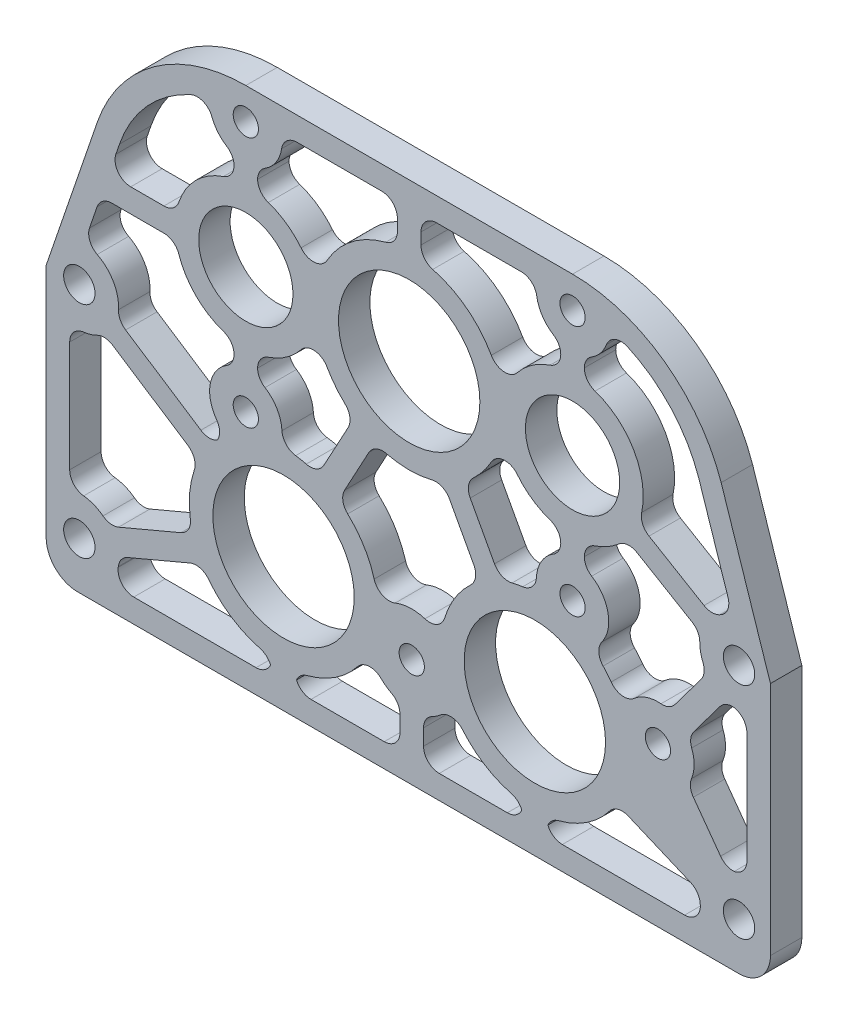
from build123d import *

# Parameters (mm, degrees)
SKETCH1_R           = 14.2875
SKETCH1_R_2         = 14.287500000000035
SKETCH1_R_3         = 14.287500000000005
SKETCH1_R_4         = 2.552699999999997
SKETCH1_R_5         = 2.5527000000000015
SKETCH1_R_6         = 2.5526999999999953
SKETCH1_R_7         = 2.5526999999999966
SKETCH1_R_8         = 9.525
SKETCH1_R_9         = 9.524999999999999
SKETCH1_R_10        = 2.5527000000000104
SKETCH1_R_11        = 2.5527000000000006
SKETCH1_R_12        = 3.175000000000977
SKETCH1_R_13        = 3.175000000000985
BOSS_EXTRUDE2_DEPTH = 6.35
FILLET1_R           = 6.35
CUT_EXTRUDE3_DEPTH  = 10.795
FILLET3_R           = 3.175
BOSS_EXTRUDE3_DEPTH = 6.35
FILLET4_R           = 3.175


with BuildPart() as part:
    # Sketch1 → Boss-Extrude2 (new body)
    with BuildSketch(Plane.XY):
        with BuildLine():
            Line((-47.98603132887341, -26.98750000000001), (98.42499999999998, -26.98750000000001))
            Line((98.42499999999998, -26.98750000000001), (98.42500000000001, 26.98749999999999))
            Line((98.42500000000001, 26.98749999999999), (88.46195482333482, 57.1775449004279))
            ThreePointArc((88.46195482333482, 57.1775449004279), (76.88457370138293, 72.73281600473805), (58.419999999999995, 78.65411069405324))
            Line((58.419999999999995, 78.65411069405324), (-7.620000000000009, 78.65411069405323))
            ThreePointArc((-7.620000000000009, 78.65411069405323), (-26.084573701382947, 72.73281600473804), (-37.661954823334845, 57.17754490042788))
            Line((-37.661954823334845, 57.17754490042788), (-47.98603132887343, 26.98749999999999))
            Line((-47.98603132887343, 26.98749999999999), (-47.98603132887341, -26.98750000000001))
        make_face()
        Circle(SKETCH1_R, mode=Mode.SUBTRACT)
        with Locations((50.80000000000001, 0)):
            Circle(SKETCH1_R_2, mode=Mode.SUBTRACT)
        with Locations((25.39999999999999, 46.90411069405324)):
            Circle(SKETCH1_R_3, mode=Mode.SUBTRACT)
        with Locations((-7.6200000000000125, 72.30411069405324)):
            Circle(SKETCH1_R_4, mode=Mode.SUBTRACT)
        with Locations((-7.620000000000007, 21.50411069405324)):
            Circle(SKETCH1_R_5, mode=Mode.SUBTRACT)
        with Locations((58.42, 72.30411069405325)):
            Circle(SKETCH1_R_6, mode=Mode.SUBTRACT)
        with Locations((58.42000000000001, 21.504110694053246)):
            Circle(SKETCH1_R_7, mode=Mode.SUBTRACT)
        with Locations((58.419999999999995, 46.90411069405324)):
            Circle(SKETCH1_R_8, mode=Mode.SUBTRACT)
        with Locations((-7.620000000000009, 46.90411069405323)):
            Circle(SKETCH1_R_9, mode=Mode.SUBTRACT)
        with Locations((75.68317984244781, 5.097779999999989)):
            Circle(SKETCH1_R_10, mode=Mode.SUBTRACT)
        with Locations((25.916820157552216, -5.097779999999997)):
            Circle(SKETCH1_R_11, mode=Mode.SUBTRACT)
        with Locations((-41.275, 26.98749999999999)):
            Circle(SKETCH1_R_12, mode=Mode.SUBTRACT)
        with Locations((92.07499999999999, 26.98749999999999)):
            Circle(SKETCH1_R_13, mode=Mode.SUBTRACT)
        with Locations((-41.275, -17.462500000000013)):
            Circle(SKETCH1_R_12, mode=Mode.SUBTRACT)
        with Locations((92.07499999999999, -17.462500000000013)):
            Circle(SKETCH1_R_13, mode=Mode.SUBTRACT)
    extrude(amount=BOSS_EXTRUDE2_DEPTH)

    # Fillet1
    fillet1_edges = [part.edges().sort_by_distance(p)[0] for p in [
        (98.42499999999998, -26.98750000000001, 3.175),
        (-47.98603132887341, -26.98750000000001, 3.175),
    ]]
    fillet(fillet1_edges, radius=FILLET1_R)

    # Sketch3 → Cut-Extrude3 (cut)
    with BuildSketch(Plane.XY.offset(6.35)):
        with BuildLine():
            Line((-36.956198173075435, 44.52286069405322), (-40.26063056999918, 34.85991772961107))
            ThreePointArc((-40.260630569999265, 34.85991772961111), (-35.31448560941896, 32.22927207151282), (-33.33749999999902, 26.98749999999999))
            ThreePointArc((-33.33749999999902, 26.987499999999986), (-33.41208001998004, 25.90196066961234), (-33.634418585906, 24.836820594645292))
            Line((-33.63441858590588, 24.8368205946454), (-14.516078562779157, 12.336367502601007))
            ThreePointArc((-14.516078562779489, 12.336367502600337), (-13.047510630612942, 13.880380626771089), (-11.41569108705963, 15.250721196219777))
            ThreePointArc((-11.415691087059542, 15.250721196219537), (-14.893374011307559, 22.28525186672046), (-10.001250000000171, 28.420887362234687))
            Line((-10.00125000000001, 28.42088736223464), (-10.00125000000001, 32.81644571054716))
            ThreePointArc((-10.001249999999667, 32.816445710547214), (-17.722788136202837, 36.80132255785047), (-21.707664983506042, 44.52286069405366))
            Line((-21.70766498350611, 44.52286069405323), (-36.956198173075435, 44.52286069405322))
        make_face()
        with BuildLine():
            Line((-33.15566159983462, 55.636529769471686), (-35.32756812234866, 49.28536069405323))
            Line((-35.32756812234866, 49.28536069405323), (-21.70766498350611, 49.28536069405323))
            ThreePointArc((-21.707664983506042, 49.2853606940528), (-17.72278813620284, 57.00689883025599), (-10.001249999999668, 60.99177567755925))
            Line((-10.001250000000011, 60.9917756775593), (-10.001250000000011, 65.38733402587184))
            ThreePointArc((-10.001250000000171, 65.3873340258718), (-13.740187498084108, 68.29718468671356), (-14.911873650189097, 72.88783126905301))
            ThreePointArc((-14.91187365018921, 72.8878312690532), (-26.1622118018659, 66.51307644303513), (-33.15566159983462, 55.63652976947169))
        make_face()
        with BuildLine():
            Line((-43.22353132887343, 19.292882926329938), (-43.22353132887341, -9.767882926329964))
            ThreePointArc((-43.22353132887338, -9.767882926329973), (-38.86174796951349, -9.900746176490003), (-35.229365288806136, -12.319134643657591))
            Line((-35.22936528880609, -12.319134643657936), (-18.334650894259735, -5.171370861349857))
            ThreePointArc((-18.334650894259855, -5.1713708613496445), (-18.973894873865273, 1.701121193656982), (-17.122353653984312, 8.350299716051511))
            Line((-17.122353653984035, 8.35029971605184), (-36.240693677111, 20.85075280809639))
            ThreePointArc((-36.240693677110954, 20.850752808096534), (-39.54663618686575, 19.24045767537935), (-43.22353132887338, 19.292882926329952))
        make_face()
        with BuildLine():
            Line((23.53557015755222, -22.22500000000001), (23.53557015755222, -13.676108259486211))
            ThreePointArc((23.53557015755219, -13.676108259486215), (19.714337890332565, -11.484272074278785), (17.41175399161535, -7.7287335919578615))
            ThreePointArc((17.411753991615605, -7.728733591957864), (1.0264443168908546, -19.02232667326272), (-16.47899043790001, -9.5574773945639))
            Line((-16.47899043790001, -9.55747739456389), (-33.37370483244626, -16.705241176871922))
            ThreePointArc((-33.37370483244611, -16.70524117687212), (-33.34655637459399, -17.083438093744068), (-33.33749999999902, -17.462500000000013))
            ThreePointArc((-33.33749999999902, -17.462500000000016), (-33.74482632172297, -19.972557892758534), (-34.92499999999866, -22.224999999999863))
            Line((-34.924999999998604, -22.225000000000012), (23.535570157552222, -22.225000000000012))
        make_face()
        with BuildLine():
            ThreePointArc((33.96205809858209, -8.909894080430089), (31.64893251655826, -11.909604659643707), (28.298070157552345, -13.676108259486186))
            Line((28.29807015755222, -13.676108259486156), (28.29807015755222, -22.22500000000001))
            Line((28.298070157552225, -22.225000000000012), (85.72499999999897, -22.225000000000012))
            ThreePointArc((85.7249999999989, -22.2250000000002), (84.43354805324476, -19.610084316260135), (84.17370483244609, -16.705241176872093))
            Line((84.17370483244622, -16.705241176871912), (67.27899043790006, -9.557477394563913))
            ThreePointArc((67.27899043790005, -9.557477394563927), (50.42979387433956, -19.046402479852333), (33.96205809858229, -8.909894080430064))
        make_face()
        with BuildLine():
            ThreePointArc((11.094212526660076, 15.486153441487609), (16.815305248793134, 8.952542063007014), (19.041814265400653, 0.5583990347270906))
            ThreePointArc((19.041814265400927, 0.5583990347269845), (25.21333999610085, 3.7770824187896235), (31.81487826203277, 1.5708763778748782))
            ThreePointArc((31.814878262032774, 1.57087637787488), (34.22893119349048, 9.396923890823444), (39.7057874733399, 15.486153441487637))
            Line((39.70578747334045, 15.486153441487858), (32.306345500404845, 29.150100109708138))
            ThreePointArc((32.30634550040487, 29.15010010970815), (25.399999999999988, 27.854110694053233), (18.49365449959512, 29.150100109708145))
            Line((18.493654499595145, 29.150100109708134), (11.094212526659529, 15.486153441487827))
        make_face()
        with BuildLine():
            ThreePointArc((-0.733789074029272, 19.035862302371154), (3.1521261342067666, 18.787405377913434), (6.906345500404873, 17.75401058434508))
            Line((6.90634550040485, 17.754010584345107), (14.305787473340464, 31.41795725256541))
            ThreePointArc((14.305787473339901, 31.41795725256563), (9.005326897633584, 37.20270904962352), (6.485853365384578, 44.63308513623436))
            ThreePointArc((6.485853365384638, 44.63308513623435), (2.5222081508117062, 36.84089698889878), (-5.2387500000004685, 32.81644571054719))
            Line((-5.238750000000011, 32.81644571054712), (-5.23875000000001, 28.420887362234687))
            ThreePointArc((-5.238749999999918, 28.420887362234712), (-1.664688461549618, 25.752217980833986), (-0.3048000000000055, 21.50411069405324))
            ThreePointArc((-0.3048000000000055, 21.504110694053235), (-0.4128451797654238, 20.251485276312792), (-0.733789074029267, 19.035862302371147))
        make_face()
        with BuildLine():
            ThreePointArc((6.485853365384575, 49.1751362518721), (11.890409000038312, 60.33517360857175), (23.018749999999926, 65.8046966224709))
            Line((23.01874999999999, 65.8046966224709), (23.01874999999999, 73.89161069405323))
            Line((23.01874999999999, 73.89161069405323), (-0.4791320702592614, 73.89161069405323))
            ThreePointArc((-0.47913207025925786, 73.89161069405321), (-0.34851362788737994, 73.10263244089562), (-0.30480000000001706, 72.30411069405324))
            ThreePointArc((-0.30480000000001706, 72.30411069405324), (-1.6646884615496287, 68.0560034072725), (-5.238749999999925, 65.38733402587177))
            Line((-5.238750000000013, 65.3873340258718), (-5.238750000000013, 60.99177567755933))
            ThreePointArc((-5.238750000000456, 60.99177567755926), (2.5222081508117205, 56.96732439920767), (6.485853365384641, 49.1751362518721))
        make_face()
        with BuildLine():
            Line((27.781249999999993, 73.89161069405323), (27.781249999999993, 65.80469662247086))
            ThreePointArc((27.781250000000203, 65.80469662247089), (38.909590999961345, 60.33517360857208), (44.31414663461528, 49.17513625187318))
            ThreePointArc((44.31414663461551, 49.17513625187317), (48.27779184918861, 56.967324399208024), (56.03875000000034, 60.99177567755926))
            Line((56.03875, 60.99177567755932), (56.03875, 65.38733402587185))
            ThreePointArc((56.03874999999984, 65.38733402587181), (52.036555563082146, 68.73146627279014), (51.27913207025928, 73.89161069405337))
            Line((51.27913207025931, 73.89161069405323), (27.781249999999993, 73.89161069405323))
        make_face()
        with BuildLine():
            Line((36.49421252665954, 31.417957252565405), (43.893654499595144, 17.754010584345135))
            ThreePointArc((43.893654499595115, 17.75401058434512), (47.64787386579323, 18.787405377913473), (51.533789074029265, 19.035862302371196))
            ThreePointArc((51.53378907402926, 19.035862302371186), (51.82521934806276, 24.669710035857907), (56.03874999999985, 28.420887362234694))
            Line((56.03875000000001, 28.420887362234648), (56.03875000000001, 32.81644571054716))
            ThreePointArc((56.03875000000035, 32.816445710547214), (48.27779184918861, 36.84089698889845), (44.31414663461551, 44.63308513623329))
            ThreePointArc((44.31414663461528, 44.63308513623328), (41.79467310236612, 37.202709049623046), (36.49421252666008, 31.41795725256563))
        make_face()
        with BuildLine():
            ThreePointArc((86.77141129191, 32.893078131346314), (88.65782919870398, 34.15177595537648), (90.8231844590936, 34.82566713916977))
            Line((90.82318445909374, 34.825667139169845), (83.94770767447324, 55.65975442462171))
            ThreePointArc((83.94770767447324, 55.65975442462171), (76.95329132995386, 66.52150778768062), (65.7118736501892, 72.88783126905322))
            ThreePointArc((65.71187365018908, 72.88783126905304), (65.72936608625751, 72.59620392757364), (65.73519999999999, 72.30411069405325))
            ThreePointArc((65.73519999999999, 72.30411069405325), (64.37531153845039, 68.05600340727251), (60.80125000000009, 65.38733402587178))
            Line((60.80125, 65.38733402587181), (60.80125, 60.991775677559346))
            ThreePointArc((60.801249999999555, 60.991775677559275), (69.33225837361344, 56.12665228720982), (72.7075, 46.90411069405324))
            ThreePointArc((72.7075, 46.90411069405324), (72.46774410280621, 44.297668315623746), (71.75652301003349, 41.77870239296668))
            Line((71.75652301003355, 41.778702392966736), (86.77141129191, 32.8930781313463))
        make_face()
        with BuildLine():
            ThreePointArc((65.7352, 21.504110694053242), (64.79488786097679, 17.916220534088623), (62.21569108705957, 15.250721196219562))
            ThreePointArc((62.21569108705967, 15.25072119621981), (65.99074435348669, 11.495381071848566), (68.57894332826864, 6.841905738185394))
            ThreePointArc((68.57894332826845, 6.841905738185389), (72.11570790549615, 11.484116588300243), (77.92305777838881, 12.061622177425093))
            Line((77.9230577783889, 12.06162217742498), (85.63031518720337, 22.353932916885178))
            ThreePointArc((85.63031518720346, 22.353932916885146), (84.29077822768011, 25.435147704495904), (84.34591976745322, 28.794493361601123))
            Line((84.34591976745313, 28.794493361601035), (69.33103148557676, 37.680117623221406))
            ThreePointArc((69.3310314855768, 37.68011762322152), (65.4970765780429, 34.492517590888895), (60.80124999999956, 32.8164457105472))
            Line((60.80125000000001, 32.81644571054713), (60.80125000000001, 28.420887362234687))
            ThreePointArc((60.8012500000001, 28.420887362234716), (64.3753115384504, 25.75221798083399), (65.7352, 21.504110694053246))
        make_face()
        with BuildLine():
            Line((81.67533037001955, 0.9017958371459294), (89.55064659468412, -9.937106579381512))
            ThreePointArc((89.55064659468395, -9.93710657938173), (91.58995732793704, -9.539833791185352), (93.66250000000025, -9.685370066662468))
            Line((93.6625, -9.685370066662518), (93.66250000000001, 19.210370066662346))
            ThreePointArc((93.66249999999987, 19.210370066662367), (91.5328726433143, 19.068535157348606), (89.44244322329315, 19.49927250162425))
            Line((89.4424432232932, 19.499272501624198), (81.73518581447874, 9.20696176216401))
            ThreePointArc((81.73518581447883, 9.20696176216398), (82.67545361878842, 7.247258652301386), (82.99837984244782, 5.097779999999989))
            ThreePointArc((82.99837984244782, 5.097779999999987), (82.65978111309862, 2.897965064521601), (81.67533037001952, 0.9017958371459089))
        make_face()
    extrude(amount=-CUT_EXTRUDE3_DEPTH, mode=Mode.SUBTRACT)

    # Fillet3
    # the kernel refuses this fillet: 3.175 mm, written as the material it adds along each edge
    with BuildSketch(Plane(origin=(56.03874999999993, 28.420887362234673, 6.35), x_dir=(-0.9026615864451203, -0.4303510896423738, 0), z_dir=(0, 0, -1))) as fillet3_piece_1:
        with BuildLine():
            CenterArc((2.013377815079917, 3.1546363422735153), FILLET3_R, 205.48984323361395, 58.0174460297045)
            Line((-0.8525727218857884, 1.7882716326641204), (0, 0))
            ThreePointArc((0, 0), (0.827179473242506, 0.04691786740182201), (1.6543589464849966, 6e-17))
        make_face()
    extrude(amount=6.35)
    with BuildSketch(Plane(origin=(56.03875000000018, 32.816445710547185, 6.35), x_dir=(-6.912e-14, -1, 0), z_dir=(0, 0, -1))) as fillet3_piece_2:
        with BuildLine():
            CenterArc((2.467303823094208, 3.174999999999997), FILLET3_R, 198.55300453501653, 71.44699546497952)
            ThreePointArc((-0.542690505378594, 2.1647727272729416), (-0.22901241031763936, 1.092998854883861), (0, 0))
            Line((0, 0), (2.4673038230939888, 0))
        make_face()
    extrude(amount=6.35)
    with BuildSketch(Plane(origin=(44.31414663461539, 49.17513625187317, 6.35), x_dir=(-0.3106564180156846, 0.9505222721986393, 0), z_dir=(0, 0, -1))) as fillet3_piece_3:
        with BuildLine():
            CenterArc((8.05380478476713, 3.113971050141215), FILLET3_R, 146.69553597557774, 112.05240930244753)
            ThreePointArc((5.400252232448555, 4.857325245961331), (3.0139453596176673, 2.079766268731059), (0, 0))
            ThreePointArc((0, 0), (3.7171406698925327, 0.3661736991527103), (7.43428133978509, 7e-17))
        make_face()
    extrude(amount=6.35)
    with BuildSketch(Plane(origin=(44.31414663461539, 44.633085136233284, 6.35), x_dir=(0.40468524855155424, -0.9144560402801037, 0), z_dir=(0, 0, -1))) as fillet3_piece_4:
        with BuildLine():
            CenterArc((8.070394969384953, 3.070718523469927), FILLET3_R, 143.22225315516226, 112.05240930244727)
            ThreePointArc((5.5273343779087005, 4.971630890750557), (3.008543645854831, 2.213567949873407), (0, 0))
            ThreePointArc((0, 0), (3.6316777362232484, 0.4692666443853272), (7.2633554724465075, 3.4e-16))
        make_face()
    extrude(amount=6.35)
    with BuildSketch(Plane(origin=(36.49421252665981, 31.417957252565515, 6.35), x_dir=(0.4761904761903794, -0.8793421577438327, 0), z_dir=(0, 0, -1))) as fillet3_piece_5:
        with BuildLine():
            CenterArc((2.6186777889470427, -3.174999999999998), FILLET3_R, 89.99999999999365, 75.52248781407012)
            ThreePointArc((-0.4555027421050051, -2.3812499999996595), (-0.18983131249272292, -1.1978786233719045), (0, 0))
            Line((0, 0), (2.6186777889473944, 8e-17))
        make_face()
    extrude(amount=6.35)
    with BuildSketch(Plane(origin=(43.89365449959513, 17.754010584345124, 6.35), x_dir=(-0.47619047619047034, 0.8793421577437834, 0), z_dir=(0, 0, -1))) as fillet3_piece_6:
        with BuildLine():
            CenterArc((2.618677788947305, 3.174999999999998), FILLET3_R, 194.47751218592953, 75.52248781407002)
            ThreePointArc((-0.4555027421048378, 2.3812500000000183), (-0.18983131249265894, 1.1978786233720815), (0, 0))
            Line((0, 0), (2.618677788947282, 1.6e-16))
        make_face()
    extrude(amount=6.35)
    with BuildSketch(Plane(origin=(62.21569108705962, 15.250721196219686, 6.35), x_dir=(0.7476582166211425, -0.6640837229739128, 0), z_dir=(0, 0, -1))) as fillet3_piece_7:
        with BuildLine():
            CenterArc((3.4508943524785707, -3.163883608194416), FILLET3_R, 94.7959481933953, 79.6837430233769)
            ThreePointArc((0.2906194855289259, -2.8584531491265555), (0.28702881762328936, -1.4148179687627263), (0, 0))
            ThreePointArc((0, 0), (1.5927204703746713, -0.06669835083351225), (3.1854409407493276, -1.3e-16))
        make_face()
    extrude(amount=6.35)
    with BuildSketch(Plane(origin=(51.53378907402926, 19.03586230237119, 6.35), x_dir=(-0.9989797180153167, -0.04516107830907373, 0), z_dir=(0, 0, -1))) as fillet3_piece_8:
        with BuildLine():
            CenterArc((3.4508943524783255, 3.1638836081944257), FILLET3_R, 185.5203087832304, 79.68374302337679)
            ThreePointArc((0.2906194855286911, 2.858453149126421), (0.28702881762313, 1.4148179687626716), (0, 0))
            ThreePointArc((0, 0), (1.592720470374607, 0.06669835083344769), (3.185440940749222, 3e-17))
        make_face()
    extrude(amount=6.35)
    with BuildSketch(Plane(origin=(-14.911873650189152, 72.8878312690531, 6.35), x_dir=(-0.939644269948795, -0.3421529569540439, 0), z_dir=(0, 0, -1))) as fillet3_piece_9:
        with BuildLine():
            CenterArc((3.8374391243551575, -3.165928268399618), FILLET3_R, 85.6677418958253, 93.66315431755451)
            ThreePointArc((0.6626556206702668, -3.128851257593849), (0.504415239407089, -1.527767651699559), (0, 0))
            ThreePointArc((0, 0), (2.038639534813719, 0.07710971860327326), (4.0772790696274415, 1e-17))
        make_face()
    extrude(amount=6.35)
    with BuildSketch(Plane(origin=(-10.001250000000091, 65.38733402587181, 6.35), x_dir=(4.125e-14, -1, 0), z_dir=(0, 0, -1))) as fillet3_piece_10:
        with BuildLine():
            CenterArc((1.9811097087981904, 3.1750000000000007), FILLET3_R, 211.9825539704014, 58.01744602960099)
            ThreePointArc((-0.7119551752737626, 1.4933262711873931), (-0.31362663101836896, 0.7668542909523216), (0, 0))
            Line((0, 0), (1.9811097087983214, 0))
        make_face()
    extrude(amount=6.35)
    with BuildSketch(Plane(origin=(-10.00124999999984, 60.991775677559275, 6.35), x_dir=(-0.9699844320691688, -0.2431670239638839, 0), z_dir=(0, 0, -1))) as fillet3_piece_11:
        with BuildLine():
            CenterArc((2.4797336439432978, 3.165301598671281), FILLET3_R, 194.07353638094148, 71.4469954649793)
            Line((-0.5999669278763138, 2.393246297585949), (0, 0))
            ThreePointArc((0, 0), (1.115880139774513, 0.04364280597921014), (2.231760279549032, 2e-17))
        make_face()
    extrude(amount=6.35)
    with BuildSketch(Plane(origin=(-21.707664983506078, 49.28536069405301, 6.35), x_dir=(-1, 8.927e-14, 0), z_dir=(0, 0, -1))) as fillet3_piece_12:
        with BuildLine():
            CenterArc((2.4673038230942472, 3.174999999999997), FILLET3_R, 198.55300453501562, 71.4469954649793)
            ThreePointArc((-0.5426905053785752, 2.164772727272988), (-0.22901241031763864, 1.092998854883894), (0, 0))
            Line((0, 0), (2.467303823093964, 0))
        make_face()
    extrude(amount=6.35)
    with BuildSketch(Plane(origin=(-35.32756812234866, 49.28536069405323, 6.35), x_dir=(0.32357273090943867, 0.9462033015223567, 0), z_dir=(0, 0, -1))) as fillet3_piece_13:
        with BuildLine():
            CenterArc((FILLET3_R * 1.39882489184, FILLET3_R), FILLET3_R, 161.12087327064881, 108.87912672935113)
            Line((FILLET3_R * 0.452621590316, FILLET3_R * 1.32357273091), (0, 0))
            Line((0, 0), (FILLET3_R * 1.39882489184, 4e-17))
        make_face()
    extrude(amount=6.35)
    with BuildSketch(Plane(origin=(-40.26063056999922, 34.85991772961109, 6.35), x_dir=(0.3235727309094507, 0.9462033015223527, 0), z_dir=(0, 0, -1))) as fillet3_piece_14:
        with BuildLine():
            CenterArc((3.221392694725913, 3.1750000000000025), FILLET3_R, 188.2132107017365, 81.7867892982627)
            ThreePointArc((0.07895765813665079, 2.7214285714286666), (0.15703139044878286, 1.3573036964921872), (0, 0))
            Line((0, 0), (3.221392694725868, 3e-17))
        make_face()
    extrude(amount=6.35)
    with BuildSketch(Plane(origin=(-36.956198173075435, 44.52286069405322, 6.35), x_dir=(1, 0, 0), z_dir=(0, 0, -1))) as fillet3_piece_15:
        with BuildLine():
            CenterArc((FILLET3_R * 0.714885762925, FILLET3_R), FILLET3_R, 198.87912672935119, 71.12087327064881)
            Line((-FILLET3_R * 0.231317538598, FILLET3_R * 0.676427269091), (0, 0))
            Line((0, 0), (FILLET3_R * 0.714885762925, 0))
        make_face()
    extrude(amount=6.35)
    with BuildSketch(Plane(origin=(-21.707664983506078, 44.52286069405345, 6.35), x_dir=(-1, -8.927e-14, 0), z_dir=(0, 0, -1))) as fillet3_piece_16:
        with BuildLine():
            CenterArc((2.4673038230942472, -3.174999999999997), FILLET3_R, 90.00000000000512, 71.44699546497927)
            ThreePointArc((-0.5426905053785752, -2.164772727272988), (-0.22901241031763864, -1.092998854883894), (0, 0))
            Line((0, 0), (2.467303823093964, 0))
        make_face()
    extrude(amount=6.35)
    with BuildSketch(Plane(origin=(-10.001249999999839, 32.816445710547185, 6.35), x_dir=(-6.912e-14, -1, 0), z_dir=(0, 0, -1))) as fillet3_piece_17:
        with BuildLine():
            CenterArc((2.4673038230941975, 3.1750000000000007), FILLET3_R, 198.55300453501675, 71.4469954649793)
            ThreePointArc((-0.5426905053786011, 2.1647727272729327), (-0.22901241031764646, 1.0929988548838627), (0, 0))
            Line((0, 0), (2.467303823093978, 0))
        make_face()
    extrude(amount=6.35)
    with BuildSketch(Plane(origin=(-10.001250000000091, 28.420887362234666, 6.35), x_dir=(-0.9026615864451208, -0.43035108964237306, 0), z_dir=(0, 0, -1))) as fillet3_piece_18:
        with BuildLine():
            CenterArc((2.0133778150799326, 3.154636342273516), FILLET3_R, 205.48984323361378, 58.017446029704615)
            Line((-0.8525727218857788, 1.7882716326641293), (0, 0))
            ThreePointArc((0, 0), (0.8271794732425046, 0.04691786740182449), (1.6543589464850081, 1e-17))
        make_face()
    extrude(amount=6.35)
    with BuildSketch(Plane(origin=(-0.7337890740292698, 19.03586230237115, 6.35), x_dir=(0.14597502011075403, 0.9892882762388651, 0), z_dir=(0, 0, -1))) as fillet3_piece_19:
        with BuildLine():
            CenterArc((3.496710719618305, 3.113172892962221), FILLET3_R, 178.9906232299229, 79.6837430233769)
            ThreePointArc((0.3222033983878793, 3.16910380976526), (0.2274579750323539, 1.577805449460874), (0, 0))
            ThreePointArc((0, 0), (1.4365944183310597, 0.1424496546150409), (2.873188836662114, -1e-17))
        make_face()
    extrude(amount=6.35)
    with BuildSketch(Plane(origin=(-11.415691087059589, 15.250721196219658, 6.35), x_dir=(-0.7476582166211397, -0.6640837229739159, 0), z_dir=(0, 0, -1))) as fillet3_piece_20:
        with BuildLine():
            CenterArc((3.4508943524785956, 3.163883608194414), FILLET3_R, 185.5203087832279, 79.68374302337696)
            ThreePointArc((0.29061948552895245, 2.858453149126548), (0.2870288176233108, 1.4148179687627234), (0, 0))
            ThreePointArc((0, 0), (1.592720470374687, 0.06669835083351164), (3.185440940749363, 9e-17))
        make_face()
    extrude(amount=6.35)
    with BuildSketch(Plane(origin=(-14.516078562779324, 12.336367502600671, 6.35), x_dir=(-0.8369696139734673, 0.5472493629828227, 0), z_dir=(0, 0, -1))) as fillet3_piece_21:
        with BuildLine():
            CenterArc((2.618677788947602, 3.1750000000000007), FILLET3_R, 194.47751218592177, 75.52248781407002)
            ThreePointArc((-0.4555027421046478, 2.3812500000004384), (-0.18983131249259916, 1.1978786233722771), (0, 0))
            Line((0, 0), (2.618677788947147, 1.9e-16))
        make_face()
    extrude(amount=6.35)
    with BuildSketch(Plane(origin=(-33.634418585905934, 24.836820594645346, 6.35), x_dir=(0.16418185547885664, 0.9864300879086768, 0), z_dir=(0, 0, -1))) as fillet3_piece_22:
        with BuildLine():
            CenterArc((2.080920099321302, 3.156000772515409), FILLET3_R, 203.72880156182535, 60.00000000004013)
            Line((-0.8256667523179736, 1.8783553311359642), (0, 0))
            ThreePointArc((0, 0), (0.8670500413839299, 0.04749806871148401), (1.734100082767854, 1e-17))
        make_face()
    extrude(amount=6.35)
    with BuildSketch(Plane(origin=(-43.223531328873406, 19.292882926329945, 6.35), x_dir=(0.9976402070761756, -0.06865870101455127, 0), z_dir=(0, 0, -1))) as fillet3_piece_23:
        with BuildLine():
            CenterArc((3.397513884837703, 3.12409720026948), FILLET3_R, 176.0630489211219, 83.66344825871244)
            Line((0.2300062273708514, 3.3420885759907244), (0, 0))
            ThreePointArc((0, 0), (1.415630785349083, 0.12725699932631354), (2.831261570698154, -1e-17))
        make_face()
    extrude(amount=6.35)
    with BuildSketch(Plane(origin=(-36.240693677110976, 20.850752808096463, 6.35), x_dir=(0.8369696139735282, -0.5472493629827294, 0), z_dir=(0, 0, -1))) as fillet3_piece_24:
        with BuildLine():
            CenterArc((2.0518148883099774, 3.174999999999998), FILLET3_R, 209.9999999999892, 60.00000000000898)
            ThreePointArc((-0.6978157687059114, 1.5875000000005175), (-0.3054252821506969, 0.8128636034529763), (0, 0))
            Line((0, 0), (2.051814888309876, -1.3e-16))
        make_face()
    extrude(amount=6.35)
    with BuildSketch(Plane(origin=(-18.334650894259795, -5.171370861349752, 6.35), x_dir=(-0.920967251068541, -0.3896399908367399, 0), z_dir=(0, 0, -1))) as fillet3_piece_25:
        with BuildLine():
            CenterArc((2.618677788947195, 3.175), FILLET3_R, 194.47751218593254, 75.52248781407008)
            ThreePointArc((-0.45550274210490643, 2.3812499999998598), (-0.1898313124926886, 1.1978786233720045), (0, 0))
            Line((0, 0), (2.618677788947339, 4e-17))
        make_face()
    extrude(amount=6.35)
    with BuildSketch(Plane(origin=(-17.122353653984177, 8.350299716051676, 6.35), x_dir=(-0.836969613973501, 0.547249362982771, 0), z_dir=(0, 0, -1))) as fillet3_piece_26:
        with BuildLine():
            CenterArc((2.6186777889471125, -3.1749999999999994), FILLET3_R, 89.99999999999538, 75.52248781406998)
            ThreePointArc((-0.45550274210495856, -2.381249999999746), (-0.18983131249270868, -1.1978786233719507), (0, 0))
            Line((0, 0), (2.6186777889473682, 3e-17))
        make_face()
    extrude(amount=6.35)
    with BuildSketch(Plane(origin=(-33.37370483244618, -16.705241176872022, 6.35), x_dir=(0.9209672510685357, 0.38963999083675266, 0), z_dir=(0, 0, -1))) as fillet3_piece_27:
        with BuildLine():
            CenterArc((2.051814888309813, 3.1749999999999994), FILLET3_R, 209.99999999999727, 60.00000000000614)
            ThreePointArc((-0.6978157687058519, 1.5875000000001325), (-0.3054252821506189, 0.8128636034528074), (0, 0))
            Line((0, 0), (2.0518148883100005, 0))
        make_face()
    extrude(amount=6.35)
    with BuildSketch(Plane(origin=(-43.22353132887339, -9.767882926329968, 6.35), x_dir=(-6.36e-15, 1, 0), z_dir=(0, 0, -1))) as fillet3_piece_28:
        with BuildLine():
            CenterArc((3.34999386781482, 3.174999999999997), FILLET3_R, 186.33655174128884, 83.66344825871147)
            ThreePointArc((0.19439074167657444, 2.824580379678126), (0.22415206999806608, 1.403552889570308), (0, 0))
            Line((0, 0), (3.349993867814838, 0))
        make_face()
    extrude(amount=6.35)
    with BuildSketch(Plane(origin=(-35.229365288806115, -12.319134643657764, 6.35), x_dir=(-0.727304593457433, 0.6863148172199971, 0), z_dir=(0, 0, -1))) as fillet3_piece_29:
        with BuildLine():
            CenterArc((2.0809200993211294, 3.1560007725153914), FILLET3_R, 203.7288015618235, 60.00000000003871)
            Line((-0.8256667523181903, 1.878355331136039), (0, 0))
            ThreePointArc((0, 0), (0.8670500413837633, 0.04749806871152959), (1.7341000827675022, 9e-17))
        make_face()
    extrude(amount=6.35)
    with BuildSketch(Plane(origin=(-34.92499999999863, -22.224999999999937, 6.35), x_dir=(1, -1.605e-14, 0), z_dir=(0, 0, -1))) as fillet3_piece_30:
        with BuildLine():
            CenterArc((4.648522628061904, -3.1750000000000007), FILLET3_R, 89.99999999999909, 98.21321070174031)
            ThreePointArc((1.5060875914726624, -3.6285714285714965), (0.9810888561798742, -1.7196325311827587), (0, 0))
            Line((0, 0), (4.648522628061954, 0))
        make_face()
    extrude(amount=6.35)
    with BuildSketch(Plane(origin=(-16.47899043790001, -9.557477394563895, 6.35), x_dir=(0.5557332549388175, -0.8313606614190421, 0), z_dir=(0, 0, -1))) as fillet3_piece_31:
        with BuildLine():
            CenterArc((2.626459909488293, 3.1685654019092984), FILLET3_R, 190.82913398369394, 75.52248781407013)
            Line((-0.4919991931658756, 2.572043964680628), (0, 0))
            ThreePointArc((0, 0), (1.2122122659176666, 0.03860758854421339), (2.424424531835343, 1e-17))
        make_face()
    extrude(amount=6.35)
    with BuildSketch(Plane(origin=(19.041814265400788, 0.5583990347270393, 6.35), x_dir=(0.8056594597691277, 0.5923789622231003, 0), z_dir=(0, 0, -1))) as fillet3_piece_32:
        with BuildLine():
            CenterArc((5.157049263094111, -3.0775902286540697), FILLET3_R, 104.22930476264393, 96.18578718627185)
            ThreePointArc((2.181470563397115, -4.1850902972362505), (1.2208398707238879, -2.0247283726434024), (0, 0))
            ThreePointArc((0, 0), (2.1883120662403295, -0.27313699885398723), (4.376624132480681, 0))
        make_face()
    extrude(amount=6.35)
    with BuildSketch(Plane(origin=(17.411753991615477, -7.728733591957863, 6.35), x_dir=(0.5212809257487098, -0.8533851395768314, 0), z_dir=(0, 0, -1))) as fillet3_piece_33:
        with BuildLine():
            CenterArc((5.157049263095008, 3.077590228653994), FILLET3_R, 159.58490805107863, 96.18578718627191)
            ThreePointArc((2.1814705633981206, 4.1850902972364645), (1.220839870724533, 2.024728372643415), (0, 0))
            ThreePointArc((0, 0), (2.1883120662406514, 0.2731369988541982), (4.376624132481283, -1.8e-16))
        make_face()
    extrude(amount=6.35)
    with BuildSketch(Plane(origin=(23.535570157552204, -13.676108259486213, 6.35), x_dir=(6.62e-15, -1, 0), z_dir=(0, 0, -1))) as fillet3_piece_34:
        with BuildLine():
            CenterArc((2.145426830383546, 3.1750000000000007), FILLET3_R, 207.38982165441948, 62.61017834558089)
            ThreePointArc((-0.6736465370900209, 1.714366456361744), (-0.2923661788114118, 0.8746522847160295), (0, 0))
            Line((0, 0), (2.145426830383567, 0))
        make_face()
    extrude(amount=6.35)
    with BuildSketch(Plane(origin=(23.535570157552222, -22.22500000000001, 6.35), x_dir=(-1, -1.12e-15, 0), z_dir=(0, 0, -1))) as fillet3_piece_35:
        with BuildLine():
            CenterArc((FILLET3_R, FILLET3_R), FILLET3_R, 180, 90.00000000000006)
            Line((0, FILLET3_R), (0, 0))
            Line((0, 0), (FILLET3_R, 0))
        make_face()
    extrude(amount=6.35)
    with BuildSketch(Plane(origin=(28.298070157552225, -22.22500000000001, 6.35), x_dir=(-1.12e-15, 1, 0), z_dir=(0, 0, -1))) as fillet3_piece_36:
        with BuildLine():
            CenterArc((FILLET3_R, FILLET3_R), FILLET3_R, 180, 90.00000000000006)
            Line((-3.55e-15, FILLET3_R), (0, 0))
            Line((0, 0), (FILLET3_R, 0))
        make_face()
    extrude(amount=6.35)
    with BuildSketch(Plane(origin=(28.29807015755228, -13.676108259486172, 6.35), x_dir=(-2.815e-14, -1, 0), z_dir=(0, 0, -1))) as fillet3_piece_37:
        with BuildLine():
            CenterArc((2.145426830383508, -3.1750000000000007), FILLET3_R, 89.9999999999984, 62.61017834558088)
            ThreePointArc((-0.6736465370900259, -1.7143664563616834), (-0.2923661788114005, -0.8746522847160019), (0, 0))
            Line((0, 0), (2.145426830383597, 0))
        make_face()
    extrude(amount=6.35)
    with BuildSketch(Plane(origin=(31.81487826203277, 1.570876377874879, 6.35), x_dir=(-0.8708999148471656, 0.491460413786502, 0), z_dir=(0, 0, -1))) as fillet3_piece_38:
        with BuildLine():
            CenterArc((4.381541575174063, 3.1049908517122264), FILLET3_R, 167.37586702488548, 90.56976543862072)
            ThreePointArc((1.283297855915406, 3.798900684525031), (0.741880226661982, 1.8655914390153765), (0, 0))
            ThreePointArc((0, 0), (1.8592376780853617, 0.19630565179891846), (3.718475356170725, -8e-17))
        make_face()
    extrude(amount=6.35)
    with BuildSketch(Plane(origin=(33.96205809858219, -8.909894080430075, 6.35), x_dir=(0.5581368192812248, -0.8297489324865912, 0), z_dir=(0, 0, -1))) as fillet3_piece_39:
        with BuildLine():
            CenterArc((4.3439505076358405, 3.15736737669275), FILLET3_R, 173.3890037873599, 90.56976543862072)
            ThreePointArc((1.1900620714747194, 3.522898130869693), (0.7810117798758797, 1.6986233403068625), (0, 0))
            ThreePointArc((0, 0), (2.0049002342934936, 0.10579573984349928), (4.009800468586999, 3e-17))
        make_face()
    extrude(amount=6.35)
    with BuildSketch(Plane(origin=(67.27899043790006, -9.557477394563922, 6.35), x_dir=(0.92096725106856, -0.3896399908366952, 0), z_dir=(0, 0, -1))) as fillet3_piece_40:
        with BuildLine():
            CenterArc((2.618677788947275, 3.1750000000000003), FILLET3_R, 194.4775121859301, 75.52248781407025)
            ThreePointArc((-0.45550274210485997, 2.381249999999991), (-0.18983131249267285, 1.19787862337207), (0, 0))
            Line((0, 0), (2.6186777889472928, -9e-17))
        make_face()
    extrude(amount=6.35)
    with BuildSketch(Plane(origin=(84.17370483244616, -16.705241176872, 6.35), x_dir=(0.013904609685133523, -0.9999033262418444, 0), z_dir=(0, 0, -1))) as fillet3_piece_41:
        with BuildLine():
            CenterArc((2.0809200993212307, 3.156000772515401), FILLET3_R, 203.72880156182498, 60.00000000003786)
            Line((-0.8256667523180563, 1.878355331135975), (0, 0))
            ThreePointArc((0, 0), (0.8670500413838189, 0.04749806871152253), (1.7341000827676394, 0))
        make_face()
    extrude(amount=6.35)
    with BuildSketch(Plane(origin=(85.72499999999894, -22.225000000000108, 6.35), x_dir=(-1, 2.064e-14, 0), z_dir=(0, 0, -1))) as fillet3_piece_42:
        with BuildLine():
            CenterArc((4.648522628062404, 3.1750000000000007), FILLET3_R, 171.78678929826137, 98.21321070173747)
            ThreePointArc((1.5060875914731648, 3.628571428571452), (0.981088856180456, 1.7196325311826197), (0, 0))
            Line((0, 0), (4.648522628062338, 0))
        make_face()
    extrude(amount=6.35)
    with BuildSketch(Plane(origin=(93.66250000000012, -9.685370066662493, 6.35), x_dir=(-3.97e-14, 1, 0), z_dir=(0, 0, -1))) as fillet3_piece_43:
        with BuildLine():
            CenterArc((3.22139269472609, -3.174999999999997), FILLET3_R, 90.00000000000232, 81.78678929826266)
            ThreePointArc((0.07895765813681668, -2.7214285714287425), (0.15703139044886844, -1.3573036964922176), (0, 0))
            Line((0, 0), (3.221392694725962, 0))
        make_face()
    extrude(amount=6.35)
    with BuildSketch(Plane(origin=(89.55064659468404, -9.93710657938162, 6.35), x_dir=(-0.5878044343616169, 0.8090030574384869, 0), z_dir=(0, 0, -1))) as fillet3_piece_44:
        with BuildLine():
            CenterArc((2.0518148883100196, 3.1749999999999963), FILLET3_R, 209.9999999999874, 60.0000000000087)
            ThreePointArc((-0.6978157687059225, 1.5875000000006014), (-0.3054252821507059, 0.8128636034530169), (0, 0))
            Line((0, 0), (2.0518148883098046, 6e-17))
        make_face()
    extrude(amount=6.35)
    with BuildSketch(Plane(origin=(81.73518581447878, 9.206961762163996, 6.35), x_dir=(0.5994037617345724, 0.8004468317249085, 0), z_dir=(0, 0, -1))) as fillet3_piece_45:
        with BuildLine():
            CenterArc((1.98110970879819, 3.1750000000000007), FILLET3_R, 211.98255397039944, 58.017446029601786)
            ThreePointArc((-0.7119551752738191, 1.4933262711874857), (-0.3136266310183939, 0.7668542909523661), (0, 0))
            Line((0, 0), (1.9811097087982568, -9e-17))
        make_face()
    extrude(amount=6.35)
    with BuildSketch(Plane(origin=(81.67533037001954, 0.9017958371459192, 6.35), x_dir=(0.4772937044421703, 0.8787438305330344, 0), z_dir=(0, 0, -1))) as fillet3_piece_46:
        with BuildLine():
            CenterArc((2.0133778150801547, 3.1546363422735144), FILLET3_R, 205.48984323361418, 58.01744602970348)
            Line((-0.852572721885545, 1.7882716326641084), (0, 0))
            ThreePointArc((0, 0), (0.8271794732425943, 0.04691786740183755), (1.654358946485191, -7e-17))
        make_face()
    extrude(amount=6.35)
    with BuildSketch(Plane(origin=(89.44244322329317, 19.499272501624223, 6.35), x_dir=(0.9739822740958035, -0.22662420379819795, 0), z_dir=(0, 0, -1))) as fillet3_piece_47:
        with BuildLine():
            CenterArc((2.0809200993214176, 3.156000772515403), FILLET3_R, 203.72880156182384, 60.000000000040586)
            Line((-0.8256667523178972, 1.8783553311360328), (0, 0))
            ThreePointArc((0, 0), (0.8670500413839431, 0.04749806871149541), (1.7341000827679114, 2e-17))
        make_face()
    extrude(amount=6.35)
    with BuildSketch(Plane(origin=(93.66249999999994, 19.210370066662357, 6.35), x_dir=(2.206e-14, -1, 0), z_dir=(0, 0, -1))) as fillet3_piece_48:
        with BuildLine():
            CenterArc((3.221392694725764, 3.174999999999997), FILLET3_R, 188.21321070173855, 81.78678929826276)
            ThreePointArc((0.07895765813651716, 2.7214285714285484), (0.157031390448678, 1.357303696492128), (0, 0))
            Line((0, 0), (3.221392694725836, 0))
        make_face()
    extrude(amount=6.35)
    with BuildSketch(Plane(origin=(84.34591976745318, 28.794493361601077, 6.35), x_dir=(-0.11992402101842496, -0.9927830725706257, 0), z_dir=(0, 0, -1))) as fillet3_piece_49:
        with BuildLine():
            CenterArc((2.0809200993212276, 3.1560007725154104), FILLET3_R, 203.72880156182555, 60.00000000003973)
            Line((-0.8256667523180463, 1.8783553311359558), (0, 0))
            ThreePointArc((0, 0), (0.8670500413838866, 0.04749806871148871), (1.7341000827677684, 0))
        make_face()
    extrude(amount=6.35)
    with BuildSketch(Plane(origin=(85.63031518720342, 22.353932916885164, 6.35), x_dir=(-0.5994037617346099, -0.8004468317248806, 0), z_dir=(0, 0, -1))) as fillet3_piece_50:
        with BuildLine():
            CenterArc((2.051814888309907, 3.175000000000003), FILLET3_R, 209.99999999998985, 60.000000000008754)
            ThreePointArc((-0.6978157687059661, 1.587500000000491), (-0.3054252821506807, 0.8128636034529804), (0, 0))
            Line((0, 0), (2.051814888309829, 2e-17))
        make_face()
    extrude(amount=6.35)
    with BuildSketch(Plane(origin=(77.92305777838885, 12.061622177425036, 6.35), x_dir=(-0.9804866689879824, 0.1965855842549262, 0), z_dir=(0, 0, -1))) as fillet3_piece_51:
        with BuildLine():
            CenterArc((2.0133778150798682, 3.154636342273519), FILLET3_R, 205.48984323361378, 58.01744602970507)
            Line((-0.8525727218858425, 1.7882716326641321), (0, 0))
            ThreePointArc((0, 0), (0.8271794732424854, 0.0469178674018158), (1.6543589464849726, 2e-17))
        make_face()
    extrude(amount=6.35)
    with BuildSketch(Plane(origin=(68.57894332826854, 6.841905738185391, 6.35), x_dir=(-0.4765315958752347, 0.8791573454920354, 0), z_dir=(0, 0, -1))) as fillet3_piece_52:
        with BuildLine():
            CenterArc((5.323752525662467, 3.148478813729874), FILLET3_R, 167.5244071945734, 95.06479418168612)
            ThreePointArc((2.2237202485962877, 3.834354080194456), (1.4092689494852253, 1.7446958313075278), (0, 0))
            ThreePointArc((0, 0), (2.457116550305723, 0.15912711762075085), (4.914233100611449, 1e-16))
        make_face()
    extrude(amount=6.35)
    with BuildSketch(Plane(origin=(60.80125000000005, 28.4208873622347, 6.35), x_dir=(-2.152e-14, 1, 0), z_dir=(0, 0, -1))) as fillet3_piece_53:
        with BuildLine():
            CenterArc((1.981109708798349, 3.174999999999997), FILLET3_R, 211.9825539703989, 58.017446029602354)
            ThreePointArc((-0.7119551752736798, 1.4933262711875048), (-0.313626631018368, 0.7668542909523527), (0, 0))
            Line((0, 0), (1.9811097087984173, 0))
        make_face()
    extrude(amount=6.35)
    with BuildSketch(Plane(origin=(60.80124999999978, 32.816445710547164, 6.35), x_dir=(0.9699844320691662, 0.24316702396389356, 0), z_dir=(0, 0, -1))) as fillet3_piece_54:
        with BuildLine():
            CenterArc((2.47973364394332, 3.1653015986712854), FILLET3_R, 194.073536380942, 71.44699546497947)
            Line((-0.5999669278762807, 2.393246297585928), (0, 0))
            ThreePointArc((0, 0), (1.115880139774554, 0.04364280597920973), (2.2317602795490887, -3e-17))
        make_face()
    extrude(amount=6.35)
    with BuildSketch(Plane(origin=(69.33103148557677, 37.68011762322146, 6.35), x_dir=(0.8605952272430994, -0.5092895589410783, 0), z_dir=(0, 0, -1))) as fillet3_piece_55:
        with BuildLine():
            CenterArc((2.467303823094122, 3.1750000000000025), FILLET3_R, 198.55300453501926, 71.44699546497947)
            ThreePointArc((-0.5426905053786389, 2.1647727272728017), (-0.22901241031764477, 1.0929988548838003), (0, 0))
            Line((0, 0), (2.4673038230940505, -1.1e-16))
        make_face()
    extrude(amount=6.35)
    with BuildSketch(Plane(origin=(86.77141129191, 32.89307813134631, 6.35), x_dir=(-0.8605952272431115, 0.509289558941058, 0), z_dir=(0, 0, -1))) as fillet3_piece_56:
        with BuildLine():
            CenterArc((2.051814888309935, 3.175000000000003), FILLET3_R, 209.99999999999105, 60.00000000000904)
            ThreePointArc((-0.6978157687059062, 1.5875000000004305), (-0.3054252821506601, 0.8128636034529354), (0, 0))
            Line((0, 0), (2.051814888309939, 8e-17))
        make_face()
    extrude(amount=6.35)
    with BuildSketch(Plane(origin=(90.82318445909367, 34.82566713916981, 6.35), x_dir=(-0.9477106804948179, -0.3191307977554804, 0), z_dir=(0, 0, -1))) as fillet3_piece_57:
        with BuildLine():
            CenterArc((3.1560997774502186, 3.1311230422023684), FILLET3_R, 180.3469120310705, 80.11666650750749)
            Line((-0.01884202484386345, 3.111899305686818), (0, 0))
            ThreePointArc((0, 0), (1.3150415739376218, 0.109692394494099), (2.6300831478752653, -8e-17))
        make_face()
    extrude(amount=6.35)
    with BuildSketch(Plane(origin=(71.75652301003352, 41.77870239296671, 6.35), x_dir=(0.860595227243119, -0.5092895589410451, 0), z_dir=(0, 0, -1))) as fillet3_piece_58:
        with BuildLine():
            CenterArc((2.467303823094095, -3.1750000000000025), FILLET3_R, 90.00000000000092, 71.44699546497922)
            ThreePointArc((-0.5426905053786497, -2.1647727272727737), (-0.2290124103176386, -1.0929988548837868), (0, 0))
            Line((0, 0), (2.4673038230940434, -9e-17))
        make_face()
    extrude(amount=6.35)
    with BuildSketch(Plane(origin=(65.71187365018915, 72.88783126905312, 6.35), x_dir=(0.939644269948797, -0.3421529569540385, 0), z_dir=(0, 0, -1))) as fillet3_piece_59:
        with BuildLine():
            CenterArc((3.8374391243550137, 3.1659282683996106), FILLET3_R, 180.66910378662377, 93.66315431755095)
            ThreePointArc((0.6626556206701212, 3.1288512575936425), (0.5044152394070262, 1.527767651699476), (0, 0))
            ThreePointArc((0, 0), (2.0386395348136515, -0.07710971860326697), (4.077279069627299, -2.6e-16))
        make_face()
    extrude(amount=6.35)
    with BuildSketch(Plane(origin=(60.80124999999978, 60.99177567755931, 6.35), x_dir=(8.927e-14, 1, 0), z_dir=(0, 0, -1))) as fillet3_piece_60:
        with BuildLine():
            CenterArc((2.46730382309424, 3.174999999999997), FILLET3_R, 198.5530045350155, 71.44699546497941)
            ThreePointArc((-0.5426905053785859, 2.1647727272729953), (-0.22901241031764574, 1.092998854883894), (0, 0))
            Line((0, 0), (2.467303823093957, 0))
        make_face()
    extrude(amount=6.35)
    with BuildSketch(Plane(origin=(60.801250000000046, 65.3873340258718, 6.35), x_dir=(0.9026615864448828, 0.43035108964287233, 0), z_dir=(0, 0, -1))) as fillet3_piece_61:
        with BuildLine():
            CenterArc((2.0133778150786688, 3.1546363422737413), FILLET3_R, 205.48984323364542, 58.017446029709504)
            Line((-0.8525727218862872, 1.7882716326627732), (0, 0))
            ThreePointArc((0, 0), (0.8271794732428494, 0.04691786740128981), (1.6543589464857553, -4e-17))
        make_face()
    extrude(amount=6.35)
    with BuildSketch(Plane(origin=(51.279132070259294, 73.8916106940533, 6.35), x_dir=(-1, -2.201e-14, 0), z_dir=(0, 0, -1))) as fillet3_piece_62:
        with BuildLine():
            CenterArc((3.2285168056237112, -3.174999999999997), FILLET3_R, 90.00000000000126, 81.2958904865172)
            ThreePointArc((0.0900831690123194, -2.6945217917676256), (0.17024740709532551, -1.3430750187044074), (0, 0))
            Line((0, 0), (3.2285168056236415, 0))
        make_face()
    extrude(amount=6.35)
    with BuildSketch(Plane(origin=(56.03874999999992, 65.38733402587184, 6.35), x_dir=(3.945e-14, -1, 0), z_dir=(0, 0, -1))) as fillet3_piece_63:
        with BuildLine():
            CenterArc((1.9811097087984377, 3.174999999999997), FILLET3_R, 211.982553970399, 58.01744602960321)
            ThreePointArc((-0.7119551752735894, 1.4933262711874993), (-0.3136266310183676, 0.76685429095234), (0, 0))
            Line((0, 0), (1.981109708798563, 0))
        make_face()
    extrude(amount=6.35)
    with BuildSketch(Plane(origin=(56.03875000000017, 60.99177567755929, 6.35), x_dir=(-0.9699844320691681, -0.24316702396388687, 0), z_dir=(0, 0, -1))) as fillet3_piece_64:
        with BuildLine():
            CenterArc((2.4797336439432867, 3.165301598671288), FILLET3_R, 194.07353638094165, 71.44699546497941)
            Line((-0.5999669278763193, 2.393246297585948), (0, 0))
            ThreePointArc((0, 0), (1.1158801397745284, 0.04364280597921748), (2.2317602795490337, -2e-17))
        make_face()
    extrude(amount=6.35)
    with BuildSketch(Plane(origin=(27.7812500000001, 65.80469662247087, 6.35), x_dir=(-4.07e-14, 1, 0), z_dir=(0, 0, -1))) as fillet3_piece_65:
        with BuildLine():
            CenterArc((2.6186777889472084, 3.1750000000000007), FILLET3_R, 194.47751218593226, 75.52248781407008)
            ThreePointArc((-0.45550274210489505, 2.381249999999876), (-0.18983131249269194, 1.1978786233720122), (0, 0))
            Line((0, 0), (2.6186777889473376, 0))
        make_face()
    extrude(amount=6.35)
    with BuildSketch(Plane(origin=(27.781249999999993, 73.89161069405323, 6.35), x_dir=(1, 0, 0), z_dir=(0, 0, -1))) as fillet3_piece_66:
        with BuildLine():
            CenterArc((FILLET3_R, FILLET3_R), FILLET3_R, 180, 90)
            Line((0, FILLET3_R), (0, 0))
            Line((0, 0), (FILLET3_R, 0))
        make_face()
    extrude(amount=6.35)
    with BuildSketch(Plane(origin=(23.018749999999958, 65.8046966224709, 6.35), x_dir=(-0.9821918433556441, -0.1878807676310744, 0), z_dir=(0, 0, -1))) as fillet3_piece_67:
        with BuildLine():
            CenterArc((2.6264599094882746, 3.1685654019092953), FILLET3_R, 190.82913398369402, 75.52248781406985)
            Line((-0.4919991931658938, 2.57204396468062), (0, 0))
            ThreePointArc((0, 0), (1.212212265917659, 0.03860758854421264), (2.424424531835312, -4e-17))
        make_face()
    extrude(amount=6.35)
    with BuildSketch(Plane(origin=(23.01874999999999, 73.89161069405323, 6.35), x_dir=(0, -1, 0), z_dir=(0, 0, -1))) as fillet3_piece_68:
        with BuildLine():
            CenterArc((FILLET3_R, FILLET3_R), FILLET3_R, 180, 90)
            Line((0, FILLET3_R), (0, 0))
            Line((0, 0), (FILLET3_R, 0))
        make_face()
    extrude(amount=6.35)
    with BuildSketch(Plane(origin=(-0.4791320702592601, 73.89161069405321, 6.35), x_dir=(1, 4.4e-15, 0), z_dir=(0, 0, -1))) as fillet3_piece_69:
        with BuildLine():
            CenterArc((3.228516805623644, 3.174999999999997), FILLET3_R, 188.7041095134825, 81.29589048651775)
            ThreePointArc((0.09008316901225889, 2.694521791767571), (0.17024740709524253, 1.343075018704355), (0, 0))
            Line((0, 0), (3.228516805623658, 0))
        make_face()
    extrude(amount=6.35)
    with BuildSketch(Plane(origin=(-5.238749999999969, 65.38733402587178, 6.35), x_dir=(0.9026615864451437, 0.43035108964232494, 0), z_dir=(0, 0, -1))) as fillet3_piece_70:
        with BuildLine():
            CenterArc((2.0133778150801067, 3.1546363422734904), FILLET3_R, 205.4898432336109, 58.01744602970393)
            Line((-0.8525727218856735, 1.7882716326642463), (0, 0))
            ThreePointArc((0, 0), (0.827179473242496, 0.04691786740186565), (1.6543589464849868, -5e-17))
        make_face()
    extrude(amount=6.35)
    with BuildSketch(Plane(origin=(-5.238750000000234, 60.991775677559296, 6.35), x_dir=(8.963e-14, 1, 0), z_dir=(0, 0, -1))) as fillet3_piece_71:
        with BuildLine():
            CenterArc((2.4673038230942486, 3.175), FILLET3_R, 198.5530045350155, 71.44699546497935)
            ThreePointArc((-0.5426905053785709, 2.164772727272998), (-0.22901241031763114, 1.0929988548838923), (0, 0))
            Line((0, 0), (2.467303823093964, 0))
        make_face()
    extrude(amount=6.35)
    with BuildSketch(Plane(origin=(6.485853365384606, 49.1751362518721, 6.35), x_dir=(0.3106564180156388, 0.9505222721986544, 0), z_dir=(0, 0, -1))) as fillet3_piece_72:
        with BuildLine():
            CenterArc((8.0538047847683, -3.113971050141186), FILLET3_R, 101.25205472197747, 112.05240930244719)
            ThreePointArc((5.4002522324498, -4.857325245961412), (3.013945359618395, -2.0797662687309164), (0, 0))
            ThreePointArc((0, 0), (3.7171406698930634, -0.36617369915288456), (7.434281339786111, 3e-17))
        make_face()
    extrude(amount=6.35)
    with BuildSketch(Plane(origin=(6.485853365384605, 44.63308513623436, 6.35), x_dir=(-0.4046852485515001, -0.9144560402801277, 0), z_dir=(0, 0, -1))) as fillet3_piece_73:
        with BuildLine():
            CenterArc((8.070394969386117, -3.070718523469882), FILLET3_R, 104.72533754239382, 112.0524093024473)
            ThreePointArc((5.527334377909977, -4.971630890750663), (3.0085436458555646, -2.213567949873307), (0, 0))
            ThreePointArc((0, 0), (3.6316777362237525, -0.4692666443855288), (7.263355472447491, 1e-17))
        make_face()
    extrude(amount=6.35)
    with BuildSketch(Plane(origin=(39.70578747334018, 15.486153441487748, 6.35), x_dir=(-0.7742156626494303, -0.6329218812051797, 0), z_dir=(0, 0, -1))) as fillet3_piece_74:
        with BuildLine():
            CenterArc((2.6264599094880583, 3.168565401909295), FILLET3_R, 190.82913398369274, 75.52248781407019)
            Line((-0.49199919316612245, 2.5720439646806907), (0, 0))
            ThreePointArc((0, 0), (1.2122122659175192, 0.03860758854423972), (2.424424531835044, 7e-17))
        make_face()
    extrude(amount=6.35)
    with BuildSketch(Plane(origin=(11.094212526659803, 15.486153441487719, 6.35), x_dir=(0.4761904761903783, 0.8793421577438334, 0), z_dir=(0, 0, -1))) as fillet3_piece_75:
        with BuildLine():
            CenterArc((2.618677788947046, 3.175), FILLET3_R, 194.47751218593632, 75.52248781407008)
            ThreePointArc((-0.45550274210500186, 2.381249999999656), (-0.18983131249272436, 1.1978786233719083), (0, 0))
            Line((0, 0), (2.6186777889474007, -2e-17))
        make_face()
    extrude(amount=6.35)
    with BuildSketch(Plane(origin=(32.30634550040486, 29.15010010970814, 6.35), x_dir=(0.47619047619047133, -0.8793421577437831, 0), z_dir=(0, 0, -1))) as fillet3_piece_76:
        with BuildLine():
            CenterArc((2.618677788947312, 3.1749999999999985), FILLET3_R, 194.47751218592958, 75.52248781407008)
            ThreePointArc((-0.4555027421048307, 2.381250000000016), (-0.1898313124926603, 1.1978786233720815), (0, 0))
            Line((0, 0), (2.6186777889472923, 7e-17))
        make_face()
    extrude(amount=6.35)
    with BuildSketch(Plane(origin=(18.49365449959513, 29.150100109708138, 6.35), x_dir=(0.9531497270599683, -0.30249892199065415, 0), z_dir=(0, 0, -1))) as fillet3_piece_77:
        with BuildLine():
            CenterArc((2.6264599094883065, 3.1685654019092975), FILLET3_R, 190.82913398369408, 75.52248781407002)
            Line((-0.4919991931658617, 2.5720439646806197), (0, 0))
            ThreePointArc((0, 0), (1.2122122659176804, 0.0386075885442101), (2.4244245318353563, -1e-17))
        make_face()
    extrude(amount=6.35)
    with BuildSketch(Plane(origin=(6.906345500404862, 17.754010584345096, 6.35), x_dir=(-0.9531497270599696, 0.30249892199065026, 0), z_dir=(0, 0, -1))) as fillet3_piece_78:
        with BuildLine():
            CenterArc((2.626459909488298, 3.1685654019092997), FILLET3_R, 190.82913398369433, 75.52248781407008)
            Line((-0.49199919316586593, 2.5720439646806086), (0, 0))
            ThreePointArc((0, 0), (1.2122122659176808, 0.03860758854420747), (2.4244245318353648, -3e-17))
        make_face()
    extrude(amount=6.35)
    with BuildSketch(Plane(origin=(14.305787473340182, 31.41795725256552, 6.35), x_dir=(-0.4761904761903756, -0.8793421577438348, 0), z_dir=(0, 0, -1))) as fillet3_piece_79:
        with BuildLine():
            CenterArc((2.61867778894704, 3.175), FILLET3_R, 194.47751218593646, 75.52248781407013)
            ThreePointArc((-0.4555027421050047, 2.381249999999648), (-0.18983131249272106, 1.1978786233719019), (0, 0))
            Line((0, 0), (2.618677788947404, -3e-17))
        make_face()
    extrude(amount=6.35)
    with BuildSketch(Plane(origin=(-5.238749999999964, 28.4208873622347, 6.35), x_dir=(-2.331e-14, 1, 0), z_dir=(0, 0, -1))) as fillet3_piece_80:
        with BuildLine():
            CenterArc((1.9811097087982297, 3.175), FILLET3_R, 211.98255397040035, 58.01744602960099)
            ThreePointArc((-0.7119551752737572, 1.4933262711874387), (-0.31362663101837296, 0.7668542909523441), (0, 0))
            Line((0, 0), (1.9811097087983036, 0))
        make_face()
    extrude(amount=6.35)
    with BuildSketch(Plane(origin=(-5.238750000000239, 32.81644571054716, 6.35), x_dir=(0.9699844320691673, 0.24316702396388964, 0), z_dir=(0, 0, -1))) as fillet3_piece_81:
        with BuildLine():
            CenterArc((2.4797336439433417, 3.1653015986712854), FILLET3_R, 194.07353638094182, 71.44699546497935)
            Line((-0.5999669278762642, 2.393246297585936), (0, 0))
            ThreePointArc((0, 0), (1.1158801397745488, 0.0436428059792112), (2.231760279549096, -6e-17))
        make_face()
    extrude(amount=6.35)

    # Sketch4 → Boss-Extrude3 (add, through all)
    with BuildSketch(Plane.XY.offset(6.35)):
        with BuildLine():
            Line((-2.38125, -18.900585928417666), (-2.3812499999999965, -26.98750000000001))
            Line((-2.3812499999999965, -26.98750000000001), (2.3812500000000036, -26.98750000000001))
            Line((2.3812500000000036, -26.98750000000001), (2.38125, -18.900585928417666))
            ThreePointArc((2.38125, -18.900585928417666), (1.17e-15, -19.049999999999997), (-2.38125, -18.900585928417666))
        make_face()
        with BuildLine():
            Line((48.41875000000001, -18.900585928417716), (48.41875000000001, -26.98750000000001))
            Line((48.41875000000001, -26.98750000000001), (53.18125000000001, -26.98750000000001))
            Line((53.18125000000001, -26.98750000000001), (53.18125000000001, -18.900585928417716))
            ThreePointArc((53.18125000000001, -18.900585928417716), (50.80000000000001, -19.050000000000047), (48.41875000000001, -18.900585928417716))
        make_face()
    extrude(amount=-BOSS_EXTRUDE3_DEPTH)

    # Fillet4
    # the kernel refuses this fillet: 3.175 mm, written as the material it adds along each edge
    with BuildSketch(Plane(origin=(53.18125000000001, -18.900585928417712, 6.35), x_dir=(0.9821918433556432, 0.18788076763107903, 0), z_dir=(0, 0, -1))) as fillet4_piece_1:
        with BuildLine():
            CenterArc((2.6264599094882897, 3.1685654019092993), FILLET4_R, 190.82913398369405, 75.52248781407013)
            Line((-0.49199919316587454, 2.5720439646806237), (0, 0))
            ThreePointArc((0, 0), (1.2122122659176788, 0.03860758854420773), (2.4244245318353466, -4e-17))
        make_face()
    extrude(amount=6.35)
    with BuildSketch(Plane(origin=(53.18125000000001, -22.225000000000012, 0), x_dir=(0, 1, 0), z_dir=(0, 0, 1))) as fillet4_piece_2:
        with BuildLine():
            CenterArc((FILLET4_R, -FILLET4_R), FILLET4_R, 90, 90)
            Line((0, -FILLET4_R), (0, 0))
            Line((0, 0), (FILLET4_R, 0))
        make_face()
    extrude(amount=6.35)
    with BuildSketch(Plane(origin=(48.41875000000001, -22.225000000000012, 6.35), x_dir=(-1, 0, 0), z_dir=(0, 0, -1))) as fillet4_piece_3:
        with BuildLine():
            CenterArc((FILLET4_R, FILLET4_R), FILLET4_R, 180, 90)
            Line((0, FILLET4_R), (0, 0))
            Line((0, 0), (FILLET4_R, 0))
        make_face()
    extrude(amount=6.35)
    with BuildSketch(Plane(origin=(48.41875000000001, -18.90058592841772, 6.35), x_dir=(0, -1, 0), z_dir=(0, 0, -1))) as fillet4_piece_4:
        with BuildLine():
            CenterArc((2.618677788947288, 3.174999999999997), FILLET4_R, 194.4775121859297, 75.5224878140703)
            ThreePointArc((-0.4555027421048514, 2.3812500000000085), (-0.1898313124926787, 1.1978786233720768), (0, 0))
            Line((0, 0), (2.618677788947288, 0))
        make_face()
    extrude(amount=6.35)
    with BuildSketch(Plane(origin=(-2.38125, -18.900585928417662, 6.35), x_dir=(5.1e-16, -1, 0), z_dir=(0, 0, -1))) as fillet4_piece_5:
        with BuildLine():
            CenterArc((2.6186777889472967, 3.175), FILLET4_R, 194.47751218592992, 75.52248781407013)
            ThreePointArc((-0.45550274210483843, 2.3812499999999988), (-0.18983131249266155, 1.1978786233720733), (0, 0))
            Line((0, 0), (2.6186777889472985, 0))
        make_face()
    extrude(amount=6.35)
    with BuildSketch(Plane(origin=(-2.38125, -22.225000000000012, 6.35), x_dir=(-1, 0, 0), z_dir=(0, 0, -1))) as fillet4_piece_6:
        with BuildLine():
            CenterArc((FILLET4_R, FILLET4_R), FILLET4_R, 180, 90)
            Line((2.22e-15, FILLET4_R), (0, 0))
            Line((0, 0), (FILLET4_R, 0))
        make_face()
    extrude(amount=6.35)
    with BuildSketch(Plane(origin=(2.3812500000000014, -22.225000000000012, 0), x_dir=(-2.8e-16, 1, 0), z_dir=(0, 0, 1))) as fillet4_piece_7:
        with BuildLine():
            CenterArc((FILLET4_R, -FILLET4_R), FILLET4_R, 89.99999999999999, 89.99999999999996)
            Line((-4.44e-15, -FILLET4_R), (0, 0))
            Line((0, 0), (FILLET4_R, 0))
        make_face()
    extrude(amount=6.35)
    with BuildSketch(Plane(origin=(2.3812500000000005, -18.900585928417662, 6.35), x_dir=(0.9821918433556434, 0.18788076763107775, 0), z_dir=(0, 0, -1))) as fillet4_piece_8:
        with BuildLine():
            CenterArc((2.6264599094882963, 3.1685654019092957), FILLET4_R, 190.829133983694, 75.52248781407008)
            Line((-0.4919991931658712, 2.572043964680624), (0, 0))
            ThreePointArc((0, 0), (1.2122122659176724, 0.03860758854421582), (2.424424531835344, 7e-17))
        make_face()
    extrude(amount=6.35)


solid = part.part
